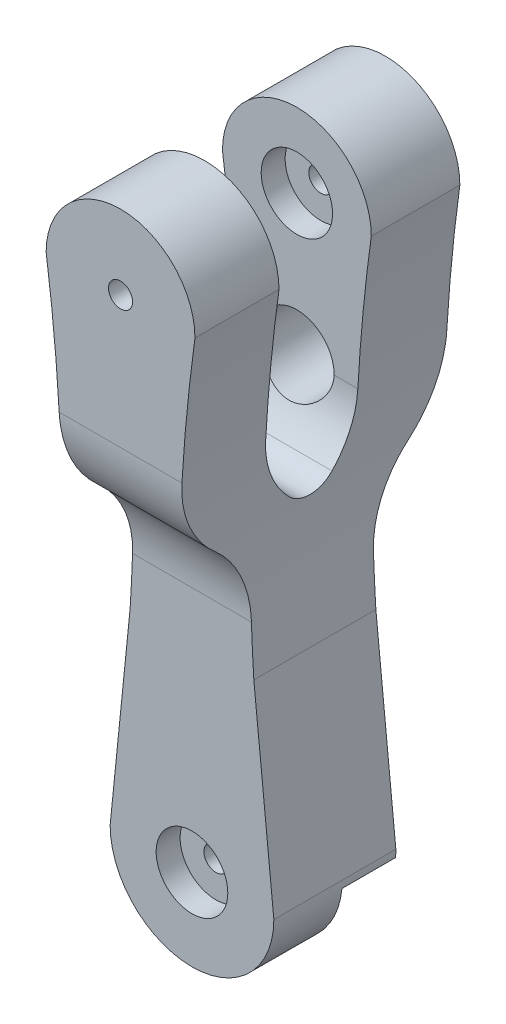
from build123d import *

# Parameters (mm, degrees)
SALIENTE_EXTRUIR1_DEPTH      = 44.5
SALIENTE_EXTRUIR1_DEPTH_BACK = 44.5
CORTAR_EXTRUIR1_START        = -24
CORTAR_EXTRUIR1_DEPTH        = 24
CORTAR_EXTRUIR2_DEPTH        = 24
REDONDEO1_R                  = 35
REDONDEO3_R                  = 35
CORTAR_EXTRUIR3_DEPTH        = 58.5
CROQUIS5_R                   = 12.500000000000016
CORTAR_EXTRUIR4_DEPTH        = 48.5
REDONDEO8_R                  = 30
REDONDEO9_R                  = 10
CORTAR_EXTRUIR5_DEPTH        = 43.05
CORTAR_EXTRUIR5_DEPTH_BACK   = 8.05
CROQUIS6_R                   = 12.000000000000016
CORTAR_EXTRUIR6_DEPTH        = 88.04999999999998
CORTAR_EXTRUIR6_DEPTH_BACK   = 28.049999999999997
CROQUIS7_R                   = 4.050000000000006
CROQUIS10_R                  = 27.5
CORTAR_EXTRUIR9_DEPTH        = 18
CORTAR_EXTRUIR14_DEPTH       = 35
CORTAR_EXTRUIR21_DEPTH       = 25
REDONDEO19_R                 = 3
CORTAR_EXTRUIR30_DEPTH       = 40
CHAFL_N1_START               = -5
CHAFL_N1_DEPTH               = 10
REDONDEO20_R                 = 35
REDONDEO21_R                 = 35
CORTAR_EXTRUIR31_DEPTH       = 15
CORTAR_EXTRUIR31_DEPTH_BACK  = 4.999999999999999
CROQUIS33_R                  = 4.05
CORTAR_EXTRUIR32_DEPTH       = 35
CROQUIS34_R                  = 12.035
CORTAR_EXTRUIR33_DEPTH       = 8.05
CORTAR_EXTRUIR35_DEPTH       = 35
CORTAR_EXTRUIR34_DEPTH       = 15
CORTAR_EXTRUIR34_DEPTH_BACK  = 5
CHAFL_N3_START               = -10
CHAFL_N3_DEPTH               = 3
CHAFL_N3_START_2             = 7.132758503
CHAFL_N3_2_DEPTH             = 2.867241497
REDONDEO23_R                 = 4
REDONDEO24_R                 = 4
REDONDEO25_R                 = 4


with BuildPart() as part:
    # Croquis1 → Saliente-Extruir1 (new, two sides: drawn at the far end of the back side and taken through both)
    with BuildSketch(Plane.XY.offset(-SALIENTE_EXTRUIR1_DEPTH_BACK)):
        with BuildLine():
            Line((27.5, 0), (20.783701773198683, 66.38093729609668))
            ThreePointArc((20.783701773198683, 66.38093729609668), (20.024433339693815, 123.29687585851822), (25.000000000000014, 180))
            ThreePointArc((25.000000000000014, 180), (1.444e-14, 205), (-24.999999999999986, 180))
            ThreePointArc((-24.999999999999986, 180), (-20.0244333396937, 123.29687585851815), (-20.78370177319863, 66.38093729609668))
            Line((-20.78370177319863, 66.38093729609668), (-27.5, 0))
            ThreePointArc((-27.5, 0), (-5.05e-15, -27.5), (27.5, 0))
        make_face()
    extrude(amount=SALIENTE_EXTRUIR1_DEPTH + SALIENTE_EXTRUIR1_DEPTH_BACK)

    # Croquis2 → Cortar-Extruir1 (cut)
    with BuildSketch(Plane.XY.offset(44.5).offset(CORTAR_EXTRUIR1_START)):
        with BuildLine():
            Line((-27.5, -1.9203e-13), (-20.783701773198548, 66.3809372960967))
            ThreePointArc((-20.783701773198548, 66.3809372960967), (-19.923071613909883, 84.36144663092024), (-19.636097648887073, 102.36025342898752))
            Line((-19.636097648887073, 102.36025342898752), (19.636097648887297, 102.36025342898373))
            ThreePointArc((19.636097648887297, 102.36025342898373), (19.9230716139067, 84.36144663091831), (20.783701773198683, 66.38093729609668))
            Line((20.783701773198683, 66.38093729609668), (27.5, 0))
            ThreePointArc((27.5, 0), (9.938e-14, -27.499999999999986), (-27.5, -1.9203e-13))
        make_face()
    extrude(amount=CORTAR_EXTRUIR1_DEPTH, mode=Mode.SUBTRACT)

    # Croquis3 → Cortar-Extruir2 (cut)
    with BuildSketch(Plane(origin=(0, 0, -44.5), x_dir=(-1, 0, 0), z_dir=(0, 0, -1))):
        with BuildLine():
            Line((-27.5, 0), (-20.783701773198683, 66.38093729609668))
            ThreePointArc((-20.783701773198683, 66.38093729609668), (-19.923071613914544, 84.36144663091848), (-19.636097648887297, 102.36025342898373))
            Line((-19.636097648887297, 102.36025342898373), (19.636097648887073, 102.36025342898358))
            ThreePointArc((19.636097648887073, 102.36025342898358), (19.92307161390545, 84.36144663091817), (20.783701773198548, 66.3809372960967))
            Line((20.783701773198548, 66.3809372960967), (27.5, 0))
            ThreePointArc((27.5, 0), (1.68e-15, -27.499999999999996), (-27.5, 0))
        make_face()
    extrude(amount=-CORTAR_EXTRUIR2_DEPTH, mode=Mode.SUBTRACT)

    # Redondeo1
    # the kernel refuses this fillet: 35 mm, written as the material it takes off along each edge
    with BuildSketch(Plane(origin=(102.70233627806806, 102.36025342898402, -44.5), x_dir=(-3.62e-15, 1, 0), z_dir=(-1, -3.62e-15, 0))) as redondeo1_piece_1:
        with BuildLine():
            CenterArc((33.22649545167231, -35), REDONDEO1_R, 90, 71.68230158880155)
            Line((1.421e-14, -24), (-0.6645299090334333, -23.78))
            ThreePointArc((-0.6645299090334333, -23.78), (-0.7000000000000028, -12), (-0.7000000000000028, 0))
            Line((-0.7000000000000028, 0), (0, 0.7000000000000028))
            Line((0, 0.7000000000000028), (33.22649545167231, 0.7000000000000028))
            Line((33.22649545167231, 0.7000000000000028), (33.22649545167231, 0))
        make_face()
    extrude(amount=205.4046725561359, mode=Mode.SUBTRACT)
    with BuildSketch(Plane(origin=(-102.7023362780678, 102.36025342899555, 44.5), x_dir=(0, 0, -1), z_dir=(1, -9.662e-14, 0))) as redondeo1_piece_2:
        with BuildLine():
            CenterArc((35, 33.22649545167229), REDONDEO1_R, 180, 71.68230158880152)
            Line((0, 33.22649545167229), (-0.7000000000000028, 33.22649545167229))
            Line((-0.7000000000000028, 33.22649545167229), (-0.7000000000000028, 0))
            Line((-0.7000000000000028, 0), (0, -0.7000000000000028))
            ThreePointArc((0, -0.7000000000000028), (12, -0.7000000000000028), (23.78, -0.6645299090334476))
            Line((23.78, -0.6645299090334476), (24, 0))
        make_face()
    extrude(amount=205.40467255613584, mode=Mode.SUBTRACT)

    # Redondeo3
    redondeo3_edges = [part.edges().sort_by_distance(p)[0] for p in [
        (1.1369e-13, 102.36025342898563, 20.5),
        (1.1013e-13, 102.36025342898365, -20.5),
    ]]
    fillet(redondeo3_edges, radius=REDONDEO3_R)

    # Croquis3D2 → Cortar-Extruir3 (cut)
    with BuildSketch(Plane(origin=(-24.999999999999105, 121.83181469642778, -14.739893982780725), x_dir=(-2.150015976069332e-12, 0.970486714162273, 0.24115459281240073), z_dir=(-1.0, 0, -8.914949664428034e-12))):
        with BuildLine():
            Line((0, 0), (121.09710255773136, 30.091213029412213))
            Line((121.09710255773136, 30.091213029412213), (128.5573844091173, -3.47e-15))
            Line((128.5573844091173, -3.47e-15), (7.6467007003513885, -30.044890126730003))
            ThreePointArc((7.6467007003513885, -30.044890126730003), (-2.3764738724496546, -25.575940038707603), (-10.455030098348384, -18.148122545589356))
            ThreePointArc((-10.455030098348384, -18.148122545589356), (-6.687251525667822, -8.233115397591352), (0, 0))
        make_face()
    extrude(amount=-CORTAR_EXTRUIR3_DEPTH, mode=Mode.SUBTRACT)

    # Croquis5 → Cortar-Extruir4 (cut)
    with BuildSketch(Plane(origin=(0, 0, -44.5), x_dir=(-1, 0, 0), z_dir=(0, 0, -1))):
        with Locations(Location((-1.01308e-12, 133.57263188887632, 0), (0, 0, 9.272454345))):
            Circle(CROQUIS5_R)
    extrude(amount=-CORTAR_EXTRUIR4_DEPTH, mode=Mode.SUBTRACT)

    # Redondeo8
    # the kernel refuses this fillet: 30 mm, written as the material it adds along each edge
    with BuildSketch(Plane(origin=(-74.1309499335336, 122.00737288868926, 16.262309706989527), x_dir=(-1.4e-16, 1, -2.11e-15), z_dir=(1.0, 0, 8.914949664428034e-12))) as redondeo8_piece_1_section:
        with BuildLine():
            CenterArc((11.787301919849192, -30), REDONDEO8_R, 90.00000000000001, 61.989437922862194)
            Line((-14.698529101666347, -15.910970398933616), (-15.228245722096654, -15.629189806912288))
            ThreePointArc((-15.228245722096654, -15.629189806912288), (-9.090373471764721, -6.347051552629107), (-0.28814898109473686, 0.5262795499485685))
            Line((-0.28814898109473686, 0.5262795499485685), (-1.27e-15, 0.6000000000000014))
            Line((-1.27e-15, 0.6000000000000014), (11.787301919849183, 0.6000000000000014))
            Line((11.787301919849183, 0.6000000000000014), (11.787301919849185, 0))
        make_face()
    redondeo8_piece_1 = extrude(amount=148.26189986706723, mode=Mode.PRIVATE)
    redondeo8_piece_1 = redondeo8_piece_1 - Plane(origin=(-584.2158848617112, 102.36025342898773, 16.262309706989527), x_dir=(0.9904993014758943, 0.13751775803788244, 0), z_dir=(0, 0, -1)) * Cylinder(564.579787212824, 361, mode=Mode.PRIVATE)
    redondeo8_piece_1 = redondeo8_piece_1 - Plane(origin=(584.2158848617221, 102.36025342898745, 16.262309706989527), x_dir=(-0.9979673304813536, -0.06372760227657126, 0), z_dir=(0, 0, -1)) * Cylinder(564.5797872128348, 361, mode=Mode.PRIVATE)
    add(redondeo8_piece_1)
    with BuildSketch(Plane(origin=(-72.33261967734306, 121.83181469642778, -14.739893983202695), x_dir=(-6.423505500299477e-12, -0.6934105693594788, 0.7205426998454454), z_dir=(1.0, 0, 8.914949664428034e-12))) as redondeo8_piece_2_section:
        with BuildLine():
            CenterArc((13.63495086661051, -29.095944858396148), REDONDEO8_R, 75.89830986699846, 60.20099506763049)
            Line((-7.981330128752852, -8.293627777611787), (-8.41365574866012, -7.8775814359961))
            Line((-8.41365574866012, -7.8775814359961), (-0.432325619907267, 0.416046341615687))
            Line((-0.432325619907267, 0.416046341615687), (-0.1881732601711261, 0.569728728568753))
            ThreePointArc((-0.1881732601711261, 0.569728728568753), (10.472129753387058, 2.284642557288499), (21.09044567957741, 0.5819188971679184))
            Line((21.09044567957741, 0.5819188971679184), (20.944259506774145, -1.06e-15))
        make_face()
    redondeo8_piece_2 = extrude(amount=120.40337198241693, mode=Mode.PRIVATE)
    redondeo8_piece_2 = redondeo8_piece_2 - Plane(origin=(-584.2158848617112, 102.36025342898773, -14.739893983202695), x_dir=(0.9904993014758943, 0.13751775803788244, 0), z_dir=(0, 0, -1)) * Cylinder(564.579787212824, 326, mode=Mode.PRIVATE)
    redondeo8_piece_2 = redondeo8_piece_2 - Plane(origin=(1.01308e-12, 133.57263188887632, -14.739893983202695), x_dir=(-0.9869332953933623, 0.16112935934831482, 0), z_dir=(0, 0, -1)) * Cylinder(12.500000000000016, 326, mode=Mode.PRIVATE)
    redondeo8_piece_2 = redondeo8_piece_2 - Plane(origin=(584.2158848617221, 102.36025342898745, -14.739893983202695), x_dir=(-0.9979673304813536, -0.06372760227657126, 0), z_dir=(0, 0, -1)) * Cylinder(564.5797872128348, 326, mode=Mode.PRIVATE)
    add(redondeo8_piece_2)
    with BuildSketch(Plane(origin=(-48.07075230507184, 121.83181469642778, -14.739893982986402), x_dir=(-6.423505500299477e-12, -0.6934105693594788, 0.7205426998454454), z_dir=(1.0, 0, 8.914949664428034e-12))) as redondeo8_piece_3_section:
        with BuildLine():
            CenterArc((13.63495086661051, -29.095944858396148), REDONDEO8_R, 75.89830986699846, 60.20099506763049)
            Line((-7.981330128752852, -8.293627777611787), (-8.41365574866012, -7.8775814359961))
            Line((-8.41365574866012, -7.8775814359961), (-0.432325619907267, 0.416046341615687))
            Line((-0.432325619907267, 0.416046341615687), (-0.1881732601711261, 0.569728728568753))
            ThreePointArc((-0.1881732601711261, 0.569728728568753), (10.472129753387064, 2.284642557288493), (21.09044567957741, 0.5819188971679184))
            Line((21.09044567957741, 0.5819188971679184), (20.944259506774145, -1.06e-15))
        make_face()
    redondeo8_piece_3 = extrude(amount=120.40337198241494, mode=Mode.PRIVATE)
    redondeo8_piece_3 = redondeo8_piece_3 - Plane(origin=(-584.2158848617112, 102.36025342898773, -14.739893982986402), x_dir=(0.9904993014758943, 0.13751775803788244, 0), z_dir=(0, 0, -1)) * Cylinder(564.579787212824, 326, mode=Mode.PRIVATE)
    redondeo8_piece_3 = redondeo8_piece_3 - Plane(origin=(1.01308e-12, 133.57263188887632, -14.739893982986402), x_dir=(-0.9869332953933623, 0.16112935934831482, 0), z_dir=(0, 0, -1)) * Cylinder(12.500000000000016, 326, mode=Mode.PRIVATE)
    redondeo8_piece_3 = redondeo8_piece_3 - Plane(origin=(584.2158848617221, 102.36025342898745, -14.739893982986402), x_dir=(-0.9979673304813536, -0.06372760227657126, 0), z_dir=(0, 0, -1)) * Cylinder(564.5797872128348, 326, mode=Mode.PRIVATE)
    add(redondeo8_piece_3)

    # Redondeo9
    redondeo9_edges = [part.edges().sort_by_distance(p)[0] for p in [
        (1.066e-14, 107.30884378702285, 0.3513393087168235),
    ]]
    fillet(redondeo9_edges, radius=REDONDEO9_R)

    # Croquis6 → Cortar-Extruir5 (cut, two sides: drawn at the far end of the back side and taken through both)
    with BuildSketch(Plane.XY.offset(-14.73989398278073).offset(-CORTAR_EXTRUIR5_DEPTH_BACK)):
        with Locations(Location((1.01308e-12, 180, 0), (0, 0, 180))):
            Circle(CROQUIS6_R)
    extrude(amount=CORTAR_EXTRUIR5_DEPTH + CORTAR_EXTRUIR5_DEPTH_BACK, mode=Mode.SUBTRACT)

    # Croquis7 → Cortar-Extruir6 (cut, two sides: drawn at the far end of the back side and taken through both)
    with BuildSketch(Plane.XY.offset(-22.78989398278073).offset(-CORTAR_EXTRUIR6_DEPTH_BACK)):
        with Locations((1.01308e-12, 180)):
            Circle(CROQUIS7_R)
    extrude(amount=CORTAR_EXTRUIR6_DEPTH + CORTAR_EXTRUIR6_DEPTH_BACK, mode=Mode.SUBTRACT)

    # Croquis10 → Cortar-Extruir9 (cut)
    with BuildSketch(Plane(origin=(0, 0, -20.499999999999996), x_dir=(-1, 0, 0), z_dir=(0, 0, -1))):
        with Locations((0, -5.041436867208791)):
            Circle(CROQUIS10_R)
    extrude(amount=-CORTAR_EXTRUIR9_DEPTH, mode=Mode.SUBTRACT)

    # Croquis12 → Cortar-Extruir14 (cut)
    with BuildSketch(Plane(origin=(25.000000000000135, 179.99999999999997, -44.5), x_dir=(1, 0, 0), z_dir=(0, 0, 1))):
        Polygon((-20.000000000000146, -95.04143686720876), (-30.000000000000146, -95.04143686720876), (-30.00000000000014, -164.05714355557723), (-20.000000000000135, -164.05714355557723), align=None)
    extrude(amount=CORTAR_EXTRUIR14_DEPTH, mode=Mode.SUBTRACT)

    # Croquis20 → Cortar-Extruir21 (cut)
    with BuildSketch(Plane(origin=(0, 0, -44.5), x_dir=(-1, 0, 0), z_dir=(0, 0, -1))):
        Polygon((-9.999999999999998, 39.456606796679445), (-6.999999999999997, 39.456606796679445), (-6.999999999999997, 29.45660679667944), (-9.999999999999996, 29.45660679667944), align=None)
        Polygon((7.000000000000003, 39.456606796679445), (7.000000000000004, 29.45660679667944), (10.000000000000004, 29.45660679667944), (10.000000000000004, 39.456606796679445), align=None)
        Polygon((-10.000000000000068, 59.45660679667944), (-10.000000000000066, 49.456606796679445), (-7.000000000000066, 49.456606796679445), (-7.000000000000066, 59.45660679667944), align=None)
        Polygon((6.999999999999934, 59.45660679667944), (6.999999999999936, 49.456606796679445), (9.999999999999934, 49.456606796679445), (9.999999999999934, 59.45660679667944), align=None)
        Polygon((-10.000000000000135, 79.45660679667944), (-10.000000000000133, 69.45660679667945), (-7.000000000000135, 69.45660679667945), (-7.000000000000135, 79.45660679667944), align=None)
        Polygon((6.999999999999866, 79.45660679667944), (6.999999999999868, 69.45660679667945), (9.999999999999867, 69.45660679667945), (9.999999999999867, 79.45660679667944), align=None)
    extrude(amount=-CORTAR_EXTRUIR21_DEPTH, mode=Mode.SUBTRACT)

    # Redondeo19
    redondeo19_edges = [part.edges().sort_by_distance(p)[0] for p in [
        (-1.066e-14, 84.95856313279121, -9.5),
    ]]
    fillet(redondeo19_edges, radius=REDONDEO19_R)

    # Croquis3D4 → Cortar-Extruir30 (cut)
    with BuildSketch(Plane(origin=(4.999999999999987, 67.67636444011245, -42.51359035531395), x_dir=(-0.316227766016838, 0.7735417661027276, -0.5492113765160671), z_dir=(0, 0.578919622222361, 0.8153846153846164))):
        Polygon((0, 0), (3.16227766016838, 9.48683298050514), (31.622776601683793, 8.7e-16), (28.460498941515414, -9.48683298050514), align=None)
    extrude(amount=CORTAR_EXTRUIR30_DEPTH, mode=Mode.SUBTRACT)

    # Chaflán1: read off the stored shape, not the designer's step
    # Chaflán1 outline → Chaflán1 (cut)
    with BuildSketch(Plane.YZ.offset(CHAFL_N1_START)):
        with BuildLine():
            Line((90.833149329, -9.89820574), (90.519642296, -9.675617075))
            Line((90.519642296, -9.675617075), (83.926878124, -10.235991145))
            ThreePointArc((83.926878124, -10.235991145), (84.688484833, -11.256003411), (84.958563133, -12.5))
            Line((84.958563133, -12.5), (84.958563133, -18.17232018))
            Line((84.958563133, -18.17232018), (90.833149329, -9.89820574))
        make_face()
    extrude(amount=CHAFL_N1_DEPTH, mode=Mode.SUBTRACT)

    # Redondeo20
    # the kernel refuses this fillet: 35 mm, written as the material it adds along each edge
    with BuildSketch(Plane(origin=(-5, 90.519642296, -9.675617075), x_dir=(0, 0.8153846155478462, -0.5789196219924586), z_dir=(1, 0, 0))) as redondeo20_piece_1:
        with BuildLine():
            CenterArc((11.708498620058515, -35), REDONDEO20_R, 90.00000000000004, 28.610275024677065)
            Line((-5.05122693500374, -4.273600937972024), (0, 0))
            Line((0, 0), (11.708498620058496, 4.6e-16))
        make_face()
    extrude(amount=10)

    # Redondeo21
    redondeo21_edges = [part.edges().sort_by_distance(p)[0] for p in [
        (0, 83.926878124, -10.235991145),
    ]]
    fillet(redondeo21_edges, radius=REDONDEO21_R)

    # Croquis32 → Cortar-Extruir31 (cut, two sides: drawn at the far end of the back side and taken through both)
    with BuildSketch(Plane.ZY.offset(-5).offset(-CORTAR_EXTRUIR31_DEPTH_BACK)):
        Polygon((-18.499999999999996, 39.456606796679445), (-15.499999999999995, 39.456606796679445), (-15.499999999999993, 29.45660679667944), (-18.499999999999993, 29.45660679667944), align=None)
        Polygon((-18.500000000000064, 59.45660679667944), (-18.50000000000006, 49.456606796679445), (-15.500000000000062, 49.456606796679445), (-15.500000000000064, 59.45660679667944), align=None)
        Polygon((-18.500000000000135, 79.45660679667944), (-18.50000000000013, 69.45660679667945), (-15.50000000000013, 69.45660679667945), (-15.500000000000131, 79.45660679667944), align=None)
    extrude(amount=CORTAR_EXTRUIR31_DEPTH + CORTAR_EXTRUIR31_DEPTH_BACK, mode=Mode.SUBTRACT)

    # Croquis33 → Cortar-Extruir32 (cut)
    with BuildSketch(Plane(origin=(0, 0, -2.4999999999999987), x_dir=(-1, 0, 0), z_dir=(0, 0, -1))):
        Circle(CROQUIS33_R)
    extrude(amount=-CORTAR_EXTRUIR32_DEPTH, mode=Mode.SUBTRACT)

    # Croquis34 → Cortar-Extruir33 (cut)
    with BuildSketch(Plane.XY.offset(20.499999999999996)):
        Circle(CROQUIS34_R)
    extrude(amount=-CORTAR_EXTRUIR33_DEPTH, mode=Mode.SUBTRACT)

    # Croquis3D5 → Cortar-Extruir35 (cut)
    with BuildSketch(Plane(origin=(-6.999999999985311, 70.1012721482082, -44.23526455400279), x_dir=(0.8589515660679107, 0.41752326934749767, -0.29643975223114166), z_dir=(-2.4204391202588653e-12, 0.57891962222249, 0.8153846153845248))):
        Polygon((0, 0), (-2.5768546982037144, 1.536170519293127), (2.5437136994400964, 10.125686179972227), (5.120568397643827, 8.589515660679085), align=None)
        Polygon((14.82556032437475, -8.589515660679101), (12.248705626171024, -7.053345141385952), (17.36927402381483, 1.5361705192931483), (19.946128722018564, -2.17e-15), align=None)
    extrude(amount=CORTAR_EXTRUIR35_DEPTH, mode=Mode.SUBTRACT)

    # Croquis37 → Cortar-Extruir34 (cut, two sides: drawn at the far end of the back side and taken through both)
    with BuildSketch(Plane.ZY.offset(-5).offset(-CORTAR_EXTRUIR34_DEPTH_BACK)):
        with BuildLine():
            Line((-22.632725635901352, 97.43749906982208), (-19.632725635901352, 97.43749906982207))
            ThreePointArc((-19.632725635901352, 97.43749906982207), (-17.78687637341474, 92.5933956839005), (-17.249077881176206, 87.4374990698221))
            Line((-17.249077881176206, 87.4374990698221), (-20.249077881176206, 87.4374990698221))
            ThreePointArc((-20.249077881176206, 87.4374990698221), (-20.76000516185466, 92.5998008342107), (-22.632725635901352, 97.43749906982208))
        make_face()
    extrude(amount=CORTAR_EXTRUIR34_DEPTH + CORTAR_EXTRUIR34_DEPTH_BACK, mode=Mode.SUBTRACT)

    # Chaflán3: read off the stored shape, not the designer's step
    # Chaflán3 outline → Chaflán3 (cut)
    with BuildSketch(Plane.YZ.offset(CHAFL_N3_START)):
        with BuildLine():
            Line((89.237177066, -17.28312496), (90.363458926, -15.696803016))
            Line((90.363458926, -15.696803016), (89.778622963, -15.28157196))
            Line((89.778622963, -15.28157196), (87.800050219, -17.242891238))
            ThreePointArc((87.800050219, -17.242891238), (88.518975571, -17.250080213), (89.237177066, -17.28312496))
        make_face()
    extrude(amount=CHAFL_N3_DEPTH, mode=Mode.SUBTRACT)

    # Chafl_n3 2 outline → Chafl_n3 2 (cut)
    with BuildSketch(Plane.YZ.offset(CHAFL_N3_START_2)):
        with BuildLine():
            Line((89.486622514, -17.300670848), (90.537585647, -15.82043225))
            Line((90.537585647, -15.82043225), (89.937678476, -15.3945007))
            Line((89.937678476, -15.3945007), (88.027386571, -17.24236789))
            ThreePointArc((88.027386571, -17.24236789), (88.757537306, -17.258185104), (89.486622514, -17.300670848))
        make_face()
    extrude(amount=CHAFL_N3_2_DEPTH, mode=Mode.SUBTRACT)

    # Redondeo23
    # the kernel refuses this fillet: 4 mm, written as the material it adds along each edge
    with BuildSketch(Plane(origin=(-18.30014989767214, 89.77862296296881, -15.281571960043975), x_dir=(2.902178888194745e-12, -0.710196513872823, -0.7040034884025002), z_dir=(1.0, 1.7044721134411297e-12, 2.4029266375854e-12))) as redondeo23_piece_1:
        with BuildLine():
            CenterArc((3.371258326804826, 3.956945213855322), REDONDEO23_R, 189.87631602884971, 71.70956448580534)
            Line((-0.5694629178613817, 3.27085770352123), (-0.6482773427546988, 3.257135953314546))
            Line((-0.6482773427546988, 3.257135953314546), (-0.07881442489331981, -0.01372175020668675))
            Line((-0.07881442489331981, -0.01372175020668675), (-2.0297e-13, -0.07999999999999713))
            ThreePointArc((-2.0297e-13, -0.07999999999999713), (1.3929755394081207, -0.08000000000346842), (2.774244933856921, -0.07913890427711161))
            Line((2.774244933856921, -0.07913890427711161), (2.785951078816686, -3e-17))
        make_face()
    extrude(amount=11.300149897555833)
    with BuildSketch(Plane(origin=(7.1327585028836955, 89.93767847601217, -15.39450069998286), x_dir=(2.8957664549581128e-12, -0.7187529955826191, -0.6952655113990708), z_dir=(1.0, 1.70447211344113e-12, 2.4029266375854e-12))) as redondeo23_piece_2:
        with BuildLine():
            CenterArc((3.332935040056438, 3.942610081459856), REDONDEO23_R, 190.5770307183757, 69.70565917320857)
            Line((-0.599101017320923, 3.20838093229434), (-0.677741738468475, 3.1936963493110335))
            Line((-0.677741738468475, 3.1936963493110335), (-0.07864072114755087, -0.0146845829833055))
            Line((-0.07864072114755087, -0.0146845829833055), (5.08e-15, -0.08000000000000464))
            ThreePointArc((5.08e-15, -0.08000000000000464), (1.3288931780044535, -0.08000000000000462), (2.644283382327945, -0.07885220162919448))
            Line((2.644283382327945, -0.07885220162919448), (2.6577863560088972, -3e-17))
        make_face()
    extrude(amount=11.026833335621923)

    # Redondeo24
    redondeo24_edges = [part.edges().sort_by_distance(p)[0] for p in [
        (-8.500000000052509, 93.74572564647447, -18.098198056733718),
        (8.566379251349963, 93.74572564647448, -18.098198056733725),
    ]]
    fillet(redondeo24_edges, radius=REDONDEO24_R)

    # Redondeo25
    # the kernel refuses this fillet: 4 mm, written as the material it takes off along each edge
    with BuildSketch(Plane(origin=(-10.00000000010822, 87.80005021898296, -17.24289123802403), x_dir=(-2.7163920668002384e-12, 0.8491825829144247, 0.5280993664783042), z_dir=(1.0, 1.7044721134411297e-12, 2.4029266375854e-12))) as redondeo25_piece_1:
        with BuildLine():
            CenterArc((0.932707736940488, 3.9878991444639746), REDONDEO25_R, 251.8828001271479, 13.659352248340497)
            Line((-0.31113928361638243, 0.1862094425745906), (-0.3360162240275251, 0.11017564853680788))
            ThreePointArc((-0.3360162240275251, 0.11017564853680788), (-0.19623001382216665, 0.02516488541647906), (-0.04170380388936395, -0.06826999883666122))
            Line((-0.04170380388936395, -0.06826999883666122), (0.006218051581709, -0.07975798288903484))
            ThreePointArc((0.006218051581709, -0.07975798288903484), (0.31090257900807633, -0.06789914446397347), (0.6155871064348929, -0.07975798288928175))
            Line((0.6155871064348929, -0.07975798288928175), (0.6218051580134328, -2e-17))
        make_face()
    extrude(amount=3, mode=Mode.SUBTRACT)
    with BuildSketch(Plane(origin=(7.132758502891392, 88.02738657101216, -17.24236788998286), x_dir=(-2.667768567343669e-12, 0.8699563278174203, 0.4931287739429014), z_dir=(1.0, 1.70447211344113e-12, 2.4029266375854e-12))) as redondeo25_piece_2:
        with BuildLine():
            CenterArc((1.0009270424349692, 3.986061061244436), REDONDEO25_R, 247.7063836588656, 17.50898272833672)
            Line((-0.5164852540948698, 0.28505310092605357), (-0.5468335000254718, 0.2110329417196876))
            ThreePointArc((-0.5468335000254718, 0.2110329417196876), (-0.2958468683338091, 0.07439175031045366), (-0.0396857228022748, -0.06946253238733299))
            Line((-0.0396857228022748, -0.06946253238733299), (0.00667284694956588, -0.07972122122489024))
            ThreePointArc((0.00667284694956588, -0.07972122122489024), (0.33364234747828475, -0.06606106124443817), (0.6606118480070172, -0.0797212212248858))
            Line((0.6606118480070172, -0.0797212212248858), (0.6672846949565878, -3e-17))
        make_face()
    extrude(amount=2.867241497, mode=Mode.SUBTRACT)


solid = part.part
